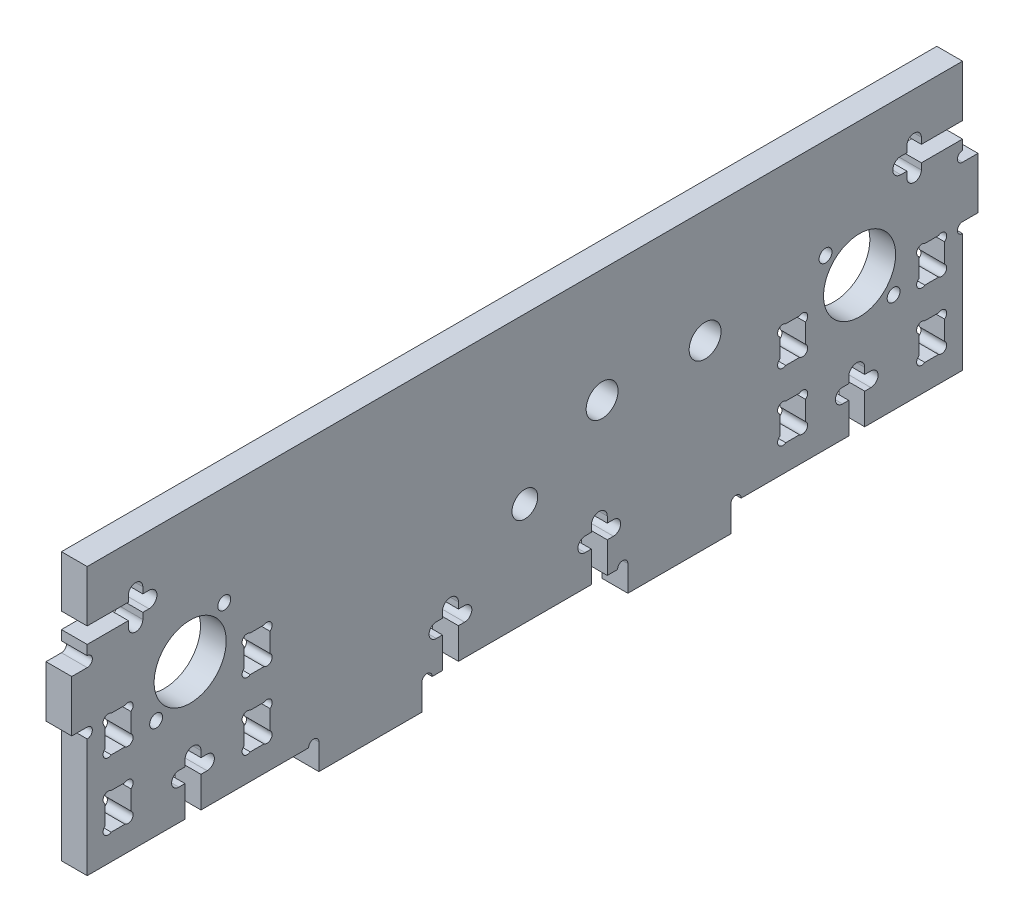
from build123d import *

# Parameters (mm, degrees)
SKETCH_1_W          = 170
SKETCH_1_H          = 52
EXTRUDE_1_DEPTH     = 5
SKETCH_2_R          = 7
CUT_EXTRUDE_1_DEPTH = 10
SKETCH_3_W          = 20
SKETCH_3_H          = 5
EXTRUDE_2_DEPTH     = 5
CUT_EXTRUDE_2_DEPTH = 10
SKETCH_8_W          = 3
SKETCH_8_H          = 10
EXTRUDE_3_DEPTH     = 5
SKETCH_7_R          = 1
CUT_EXTRUDE_3_DEPTH = 10
SKETCH_10_W         = 5
SKETCH_10_H         = 7
CUT_EXTRUDE_4_DEPTH = 10
SKETCH_11_R         = 1.000000001
SKETCH_11_R_2       = 0.999999999
CUT_EXTRUDE_5_DEPTH = 10
CUT_EXTRUDE_6_DEPTH = 10
SKETCH_13_R         = 3.1
SKETCH_13_R_2       = 2.5
CUT_EXTRUDE_7_DEPTH = 10
SKETCH_14_R         = 1.25
CUT_EXTRUDE_8_DEPTH = 10


with BuildPart() as part:
    # 스케치1 → 보스-돌출1 (new body)
    with BuildSketch(Plane(origin=(0, 0, 0), x_dir=(0, 0, -1), z_dir=(1, 0, 0))):
        with Locations((85, 26)):
            Rectangle(SKETCH_1_W, SKETCH_1_H)
    extrude(amount=EXTRUDE_1_DEPTH)

    # 스케치2 → 컷-돌출1 (cut)
    with BuildSketch(Plane(origin=(5, 0, 0), x_dir=(0, 0, -1), z_dir=(1, 0, 0))):
        with Locations((150, 26)):
            Circle(SKETCH_2_R)
        with Locations((20, 26)):
            Circle(SKETCH_2_R)
    extrude(amount=-CUT_EXTRUDE_1_DEPTH, mode=Mode.SUBTRACT)

    # 스케치3 → 보스-돌출2 (add)
    with BuildSketch(Plane(origin=(5, 0, 0), x_dir=(0, 0, -1), z_dir=(1, 0, 0))):
        with Locations((55, -2.5)):
            Rectangle(SKETCH_3_W, SKETCH_3_H)
        with Locations((115, -2.5)):
            Rectangle(SKETCH_3_W, SKETCH_3_H)
    extrude(amount=-EXTRUDE_2_DEPTH)

    # 스케치6 → 컷-돌출2 (cut)
    with BuildSketch(Plane(origin=(5, 0, 0), x_dir=(0, 0, -1), z_dir=(1, 0, 0))):
        with BuildLine():
            Line((151, 0), (151, 6))
            Line((151, 6), (152.2, 6))
            ThreePointArc((152.2, 6), (153.6, 7.4), (152.2, 8.8))
            Line((152.2, 8.8), (151, 8.8))
            Line((151, 8.8), (151, 10))
            ThreePointArc((151, 10), (149.45, 11.55), (147.9, 10))
            Line((147.9, 10), (147.9, 8.8))
            Line((147.9, 8.8), (146.7, 8.8))
            ThreePointArc((146.7, 8.8), (145.3, 7.4), (146.7, 6))
            Line((146.7, 6), (147.9, 6))
            Line((147.9, 6), (147.9, 0))
            Line((147.9, 0), (151, 0))
        make_face()
        with BuildLine():
            Line((101, 0), (101, 6))
            Line((101, 6), (102.2, 6))
            ThreePointArc((102.2, 6), (103.6, 7.4), (102.2, 8.8))
            Line((102.2, 8.8), (101, 8.8))
            Line((101, 8.8), (101, 10))
            ThreePointArc((101, 10), (99.45, 11.55), (97.9, 10))
            Line((97.9, 10), (97.9, 8.8))
            Line((97.9, 8.8), (96.7, 8.8))
            ThreePointArc((96.7, 8.8), (95.3, 7.4), (96.7, 6))
            Line((96.7, 6), (97.9, 6))
            Line((97.9, 6), (97.9, 0))
            Line((97.9, 0), (101, 0))
        make_face()
        with BuildLine():
            Line((67.8, 6), (69, 6))
            Line((69, 6), (69, 0))
            Line((69, 0), (72.1, 0))
            Line((72.1, 0), (72.1, 6))
            Line((72.1, 6), (73.3, 6))
            ThreePointArc((73.3, 6), (74.7, 7.4), (73.3, 8.8))
            Line((73.3, 8.8), (72.1, 8.8))
            Line((72.1, 8.8), (72.1, 10))
            ThreePointArc((72.1, 10), (70.55, 11.55), (69, 10))
            Line((69, 10), (69, 8.8))
            Line((69, 8.8), (67.8, 8.8))
            ThreePointArc((67.8, 8.8), (66.4, 7.4), (67.8, 6))
        make_face()
        with BuildLine():
            Line((17.8, 6), (19, 6))
            Line((19, 6), (19, 0))
            Line((19, 0), (22.1, 0))
            Line((22.1, 0), (22.1, 6))
            Line((22.1, 6), (23.3, 6))
            ThreePointArc((23.3, 6), (24.7, 7.4), (23.3, 8.8))
            Line((23.3, 8.8), (22.1, 8.8))
            Line((22.1, 8.8), (22.1, 10))
            ThreePointArc((22.1, 10), (20.55, 11.55), (19, 10))
            Line((19, 10), (19, 8.8))
            Line((19, 8.8), (17.8, 8.8))
            ThreePointArc((17.8, 8.8), (16.4, 7.4), (17.8, 6))
        make_face()
    extrude(amount=-CUT_EXTRUDE_2_DEPTH, mode=Mode.SUBTRACT)

    # 스케치8 → 보스-돌출3 (add)
    with BuildSketch(Plane(origin=(5, 0, 0), x_dir=(0, 0, -1), z_dir=(1, 0, 0))):
        with Locations((171.5, 30)):
            Rectangle(SKETCH_8_W, SKETCH_8_H)
        with Locations((-1.5, 30)):
            Rectangle(SKETCH_8_W, SKETCH_8_H)
    extrude(amount=-EXTRUDE_3_DEPTH)

    # 스케치7 → 컷-돌출3 (cut)
    with BuildSketch(Plane(origin=(5, 0, 0), x_dir=(0, 0, -1), z_dir=(1, 0, 0))):
        with Locations((66, 0)):
            Circle(SKETCH_7_R)
        with Locations((44, 0)):
            Circle(SKETCH_7_R)
        with Locations((104, 0)):
            Circle(SKETCH_7_R)
        with Locations((126, 0)):
            Circle(SKETCH_7_R)
        with Locations((170, 36)):
            Circle(SKETCH_7_R)
        with Locations((170, 24)):
            Circle(SKETCH_7_R)
        with Locations((0, 36)):
            Circle(SKETCH_7_R)
        with Locations((0, 24)):
            Circle(SKETCH_7_R)
    extrude(amount=-CUT_EXTRUDE_3_DEPTH, mode=Mode.SUBTRACT)

    # 스케치10 → 컷-돌출4 (cut)
    with BuildSketch(Plane.ZY):
        with Locations((-163.999999999, 21.5)):
            Rectangle(SKETCH_10_W, SKETCH_10_H)
        with Locations((-136.999999999, 21.5)):
            Rectangle(SKETCH_10_W, SKETCH_10_H)
        with Locations((-163.999999999, 8.5)):
            Rectangle(SKETCH_10_W, SKETCH_10_H)
        with Locations((-136.999999999, 8.5)):
            Rectangle(SKETCH_10_W, SKETCH_10_H)
        with Locations((-33.000000001, 8.5)):
            Rectangle(SKETCH_10_W, SKETCH_10_H)
        with Locations((-6.000000001, 8.5)):
            Rectangle(SKETCH_10_W, SKETCH_10_H)
        with Locations((-33.000000001, 21.5)):
            Rectangle(SKETCH_10_W, SKETCH_10_H)
        with Locations((-6.000000001, 21.5)):
            Rectangle(SKETCH_10_W, SKETCH_10_H)
    extrude(amount=-CUT_EXTRUDE_4_DEPTH, mode=Mode.SUBTRACT)

    # 스케치11 → 컷-돌출5 (cut)
    with BuildSketch(Plane(origin=(5, 0, 0), x_dir=(0, 0, -1), z_dir=(1, 0, 0))):
        with Locations((165.918761805, 24.186266529)):
            Circle(SKETCH_11_R)
        with Locations((162.081238192, 24.186266529)):
            Circle(SKETCH_11_R)
        with Locations((165.918761805, 18.813733471)):
            Circle(SKETCH_11_R)
        with Locations((162.081238192, 18.813733471)):
            Circle(SKETCH_11_R)
        with Locations((138.918761805, 18.813733471)):
            Circle(SKETCH_11_R_2)
        with Locations((135.081238192, 18.813733471)):
            Circle(SKETCH_11_R_2)
        with Locations((138.918761805, 24.186266529)):
            Circle(SKETCH_11_R_2)
        with Locations((135.081238192, 24.186266529)):
            Circle(SKETCH_11_R_2)
        with Locations((135.081238192, 5.813733471)):
            Circle(SKETCH_11_R_2)
        with Locations((138.918761805, 5.813733471)):
            Circle(SKETCH_11_R_2)
        with Locations((135.081238192, 11.186266529)):
            Circle(SKETCH_11_R_2)
        with Locations((138.918761805, 11.186266529)):
            Circle(SKETCH_11_R_2)
        with Locations((162.081238192, 11.186266529)):
            Circle(SKETCH_11_R)
        with Locations((165.918761805, 11.186266529)):
            Circle(SKETCH_11_R)
        with Locations((162.081238192, 5.813733471)):
            Circle(SKETCH_11_R)
        with Locations((165.918761805, 5.813733471)):
            Circle(SKETCH_11_R)
        with Locations((4.081238195, 5.813733471)):
            Circle(SKETCH_11_R)
        with Locations((7.918761808, 5.813733471)):
            Circle(SKETCH_11_R)
        with Locations((4.081238195, 11.186266529)):
            Circle(SKETCH_11_R)
        with Locations((7.918761808, 11.186266529)):
            Circle(SKETCH_11_R)
        with Locations((31.081238195, 11.186266529)):
            Circle(SKETCH_11_R_2)
        with Locations((34.918761808, 11.186266529)):
            Circle(SKETCH_11_R_2)
        with Locations((31.081238195, 5.813733471)):
            Circle(SKETCH_11_R_2)
        with Locations((34.918761808, 5.813733471)):
            Circle(SKETCH_11_R_2)
        with Locations((34.918761808, 24.186266529)):
            Circle(SKETCH_11_R_2)
        with Locations((31.081238195, 24.186266529)):
            Circle(SKETCH_11_R_2)
        with Locations((34.918761808, 18.813733471)):
            Circle(SKETCH_11_R_2)
        with Locations((31.081238195, 18.813733471)):
            Circle(SKETCH_11_R_2)
        with Locations((7.918761808, 18.813733471)):
            Circle(SKETCH_11_R)
        with Locations((4.081238195, 18.813733471)):
            Circle(SKETCH_11_R)
        with Locations((7.918761808, 24.186266529)):
            Circle(SKETCH_11_R)
        with Locations((4.081238195, 24.186266529)):
            Circle(SKETCH_11_R)
    extrude(amount=-CUT_EXTRUDE_5_DEPTH, mode=Mode.SUBTRACT)

    # 스케치12 → 컷-돌출6 (cut)
    with BuildSketch(Plane(origin=(5, 0, 0), x_dir=(0, 0, -1), z_dir=(1, 0, 0))):
        with BuildLine():
            Line((170, 42), (162, 42))
            Line((162, 42), (162, 43.2))
            ThreePointArc((162, 43.2), (160.6, 44.6), (159.2, 43.2))
            Line((159.2, 43.2), (159.2, 42))
            Line((159.2, 42), (158, 42))
            ThreePointArc((158, 42), (156.45, 40.45), (158, 38.9))
            Line((158, 38.9), (159.2, 38.9))
            Line((159.2, 38.9), (159.2, 37.7))
            ThreePointArc((159.2, 37.7), (160.6, 36.3), (162, 37.7))
            Line((162, 37.7), (162, 38.9))
            Line((162, 38.9), (170, 38.9))
            Line((170, 38.9), (170, 42))
        make_face()
        with BuildLine():
            Line((8, 43.2), (8, 42))
            Line((8, 42), (0, 42))
            Line((0, 42), (0, 38.9))
            Line((0, 38.9), (8, 38.9))
            Line((8, 38.9), (8, 37.7))
            ThreePointArc((8, 37.7), (9.4, 36.3), (10.8, 37.7))
            Line((10.8, 37.7), (10.8, 38.9))
            Line((10.8, 38.9), (12, 38.9))
            ThreePointArc((12, 38.9), (13.55, 40.45), (12, 42))
            Line((12, 42), (10.8, 42))
            Line((10.8, 42), (10.8, 43.2))
            ThreePointArc((10.8, 43.2), (9.4, 44.6), (8, 43.2))
        make_face()
    extrude(amount=-CUT_EXTRUDE_6_DEPTH, mode=Mode.SUBTRACT)

    # 스케치13 → 컷-돌출7 (cut)
    with BuildSketch(Plane(origin=(5, 0, 0), x_dir=(0, 0, -1), z_dir=(1, 0, 0))):
        with Locations((100, 30)):
            Circle(SKETCH_13_R)
        with Locations((120, 30)):
            Circle(SKETCH_13_R)
        with Locations((85, 20)):
            Circle(SKETCH_13_R_2)
    extrude(amount=-CUT_EXTRUDE_7_DEPTH, mode=Mode.SUBTRACT)

    # 스케치14 → 컷-돌출8 (cut)
    with BuildSketch(Plane(origin=(5, 0, 0), x_dir=(0, 0, -1), z_dir=(1, 0, 0))):
        with Locations((156.611448404, 19.388551596)):
            Circle(SKETCH_14_R)
        with Locations((143.388551596, 32.611448404)):
            Circle(SKETCH_14_R)
        with Locations((13.388551596, 19.388551596)):
            Circle(SKETCH_14_R)
        with Locations((26.611448404, 32.611448404)):
            Circle(SKETCH_14_R)
    extrude(amount=-CUT_EXTRUDE_8_DEPTH, mode=Mode.SUBTRACT)


solid = part.part
